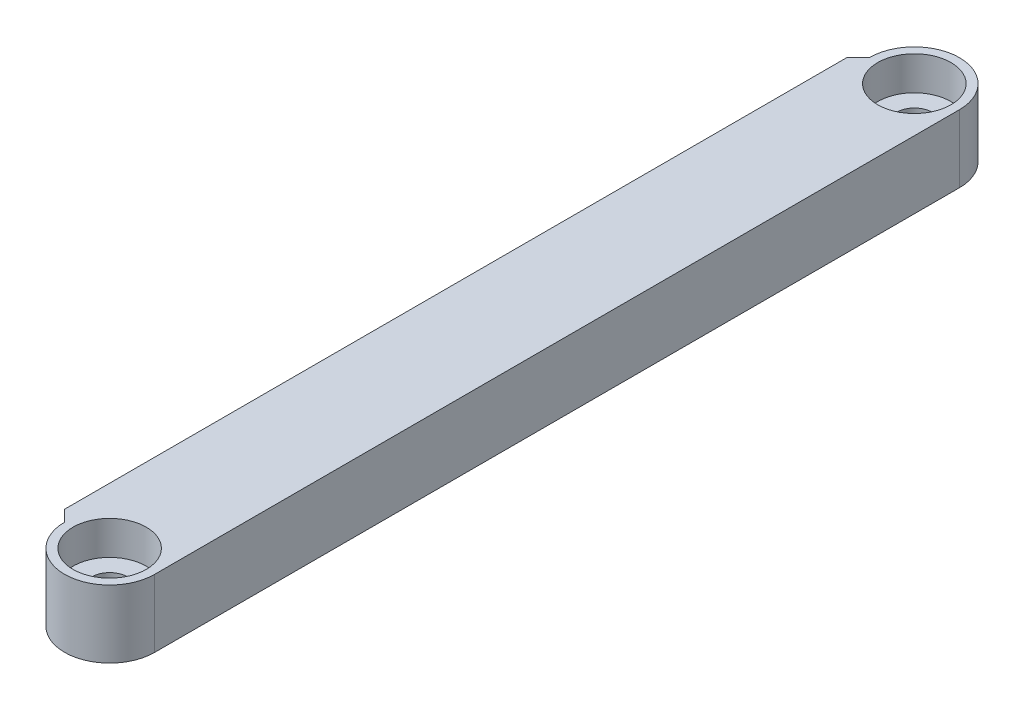
from build123d import *

# Parameters (mm, degrees)
SKETCH_1_R          = 1.6
SKETCH_1_R_2        = 1.6000000000000016
EXTRUDE_1_DEPTH     = 6
CHAMFER_1_SIZE      = 1
SKETCH_2_R          = 3.25
SKETCH_2_R_2        = 3.250000000000001
CUT_EXTRUDE_1_DEPTH = 3


with BuildPart() as part:
    # Эскиз1 → Бобышка-Вытянуть1 (new body)
    with BuildSketch(Plane(origin=(0, 0, 0), x_dir=(1, 0, 0), z_dir=(0, 1, 0))):
        with BuildLine():
            Line((-4, -9.8e-16), (-5.000000000000001, -1.1e-15))
            Line((-5.000000000000001, -1.1e-15), (-4.999999999999991, -71.4))
            Line((-4.999999999999991, -71.4), (-4.000000000000001, -71.4))
            ThreePointArc((-4.000000000000001, -71.4), (-7.3e-16, -75.4), (4, -71.4))
            Line((4, -71.4), (4, 0))
            ThreePointArc((4, 0), (2.4e-16, 4), (-4, -9.8e-16))
        make_face()
        with Locations(Location((0, 0, 0), (0, 0, 270))):
            Circle(SKETCH_1_R, mode=Mode.SUBTRACT)
        with Locations(Location((0, -71.4, 0), (0, 0, 270))):
            Circle(SKETCH_1_R_2, mode=Mode.SUBTRACT)
    extrude(amount=EXTRUDE_1_DEPTH)

    # Фаска1
    chamfer_1_edges = [part.edges().sort_by_distance(p)[0] for p in [
        (-5.000000000000001, 3, 1.1e-15),
        (-4.999999999999991, 3, 71.4),
    ]]
    chamfer(chamfer_1_edges, length=CHAMFER_1_SIZE - 0.0001)  # a hair under: the kernel refuses the full size

    # Эскиз2 → Вырез-Вытянуть1 (cut)
    with BuildSketch(Plane(origin=(0, 6, 0), x_dir=(1, 0, 0), z_dir=(0, 1, 0))):
        with Locations(Location((0, 0, 0), (0, 0, 270))):
            Circle(SKETCH_2_R)
        with Locations(Location((0, -71.4, 0), (0, 0, 270))):
            Circle(SKETCH_2_R_2)
    extrude(amount=-CUT_EXTRUDE_1_DEPTH, mode=Mode.SUBTRACT)


solid = part.part
